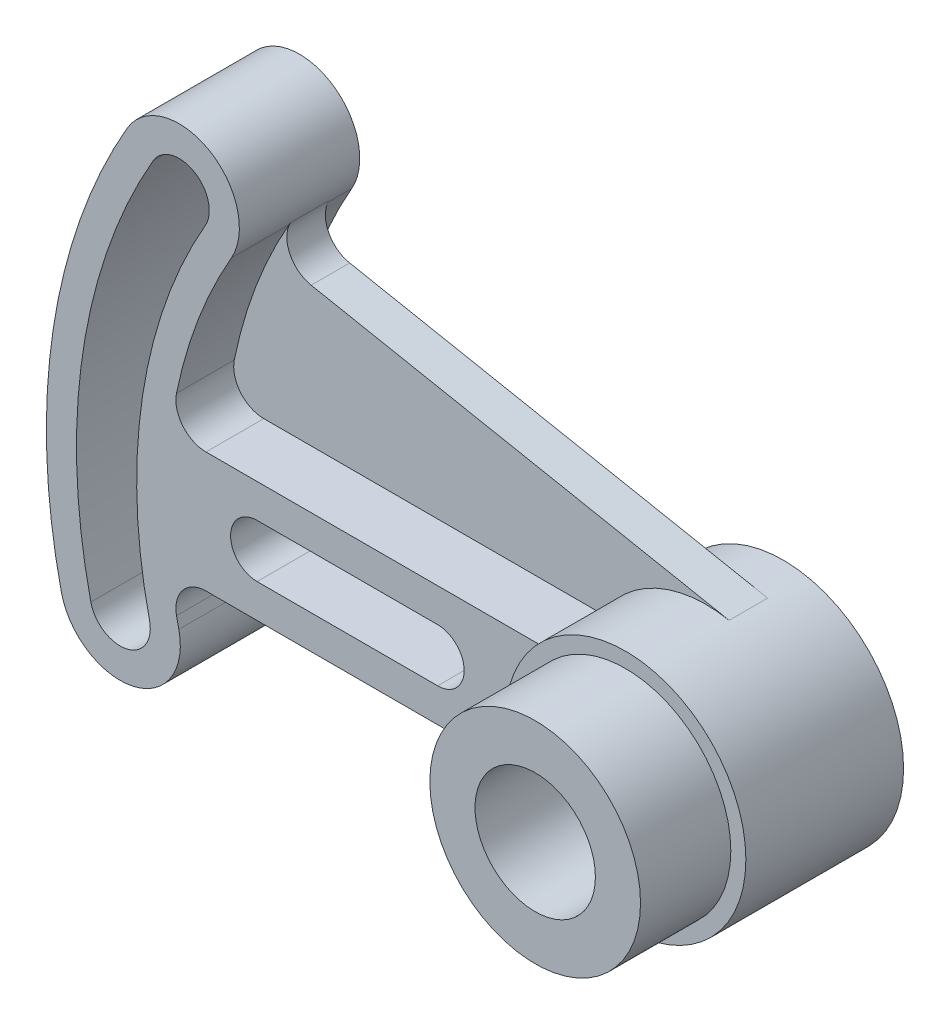
from build123d import *

# Parameters (mm, degrees)
SKETCH1_R           = 25.4
BOSS_EXTRUDE1_DEPTH = 33.274
SKETCH2_R           = 22.225
BOSS_EXTRUDE2_DEPTH = 19.05
SKETCH3_R           = 12.7
CUT_EXTRUDE2_DEPTH  = 64.467479673
BOSS_EXTRUDE3_DEPTH = 25.4
FILLET1_R           = 6.35
FILLET2_R           = 6.35
CUT_EXTRUDE3_DEPTH  = 154.088688922
BOSS_EXTRUDE4_DEPTH = 8.128
FILLET3_R           = 6.35


with BuildPart() as part:
    # Sketch1 → Boss-Extrude1 (new body)
    with BuildSketch(Plane.XY):
        Circle(SKETCH1_R)
    extrude(amount=BOSS_EXTRUDE1_DEPTH)

    # Sketch2 → Boss-Extrude2 (add)
    with BuildSketch(Plane.XY.offset(33.274)):
        with Locations(Location((0, 0, 0), (0, 0, 180))):
            Circle(SKETCH2_R)
    extrude(amount=BOSS_EXTRUDE2_DEPTH)

    # Sketch3 → Cut-Extrude2 (cut, through all)
    with BuildSketch(Plane.XY):
        Circle(SKETCH3_R)
    extrude(amount=CUT_EXTRUDE2_DEPTH, mode=Mode.SUBTRACT)

    # Sketch5 → Boss-Extrude3 (add)
    with BuildSketch(Plane(origin=(0, 0, 3.048), x_dir=(-1, 0, 0), z_dir=(0, 0, -1))):
        with BuildLine():
            Line((100.803124952, 12.7), (21.997045256, 12.7))
            ThreePointArc((21.997045256, 12.7), (24.534515988, 6.574003746), (25.4, 0))
            ThreePointArc((25.4, 0), (24.534515988, -6.574003746), (21.997045256, -12.7))
            Line((21.997045256, -12.7), (100.803124952, -12.7))
            ThreePointArc((100.803124952, -12.7), (100.053333913, -17.660418251), (99.059597973, -22.577777778))
            ThreePointArc((99.059597973, -22.577777778), (108.619825498, -37.782449747), (123.824497467, -28.222222222))
            ThreePointArc((123.824497467, -28.222222222), (125.578613792, 18.9476056), (109.985226281, 63.5))
            ThreePointArc((109.985226281, 63.5), (92.636703653, 68.148522628), (87.988181024, 50.8))
            ThreePointArc((87.988181024, 50.8), (96.298711326, 32.390094118), (100.803124952, 12.7))
        make_face()
    extrude(amount=-BOSS_EXTRUDE3_DEPTH)

    # Fillet1
    fillet1_edges = [part.edges().sort_by_distance(p)[0] for p in [
        (-100.803124952, 12.7, 15.748),
    ]]
    fillet(fillet1_edges, radius=FILLET1_R)

    # Fillet2
    fillet2_edges = [part.edges().sort_by_distance(p)[0] for p in [
        (-100.803124952, -12.7, 15.748),
    ]]
    fillet(fillet2_edges, radius=FILLET2_R)

    # Sketch6 → Cut-Extrude3 (cut, through all)
    with BuildSketch(Plane(origin=(0, 0, 3.048), x_dir=(-1, 0, 0), z_dir=(0, 0, -1))):
        with BuildLine():
            Line((44.45, -5.588), (82.55, -5.588))
            ThreePointArc((82.55, -5.588), (88.138, 0), (82.55, 5.588))
            Line((82.55, 5.588), (44.45, 5.588))
            ThreePointArc((44.45, 5.588), (38.862, 0), (44.45, -5.588))
        make_face()
        with BuildLine():
            ThreePointArc((117.620316517, -26.867892407), (119.3040242, 17.971430377), (104.485964967, 60.325))
            ThreePointArc((104.485964967, 60.325), (95.811703653, 62.649261314), (93.487442339, 53.975))
            ThreePointArc((93.487442339, 53.975), (106.745705863, 16.079700863), (105.239230568, -24.039693207))
            ThreePointArc((105.239230568, -24.039693207), (110.015673942, -31.644335781), (117.620316517, -26.867892407))
        make_face()
    extrude(amount=-CUT_EXTRUDE3_DEPTH, mode=Mode.SUBTRACT)

    # Sketch7 → Boss-Extrude4 (add)
    with BuildSketch(Plane.XY.offset(8.128)):
        with BuildLine():
            Line((-93.3255592, 12.7), (-21.997045256, 12.7))
            ThreePointArc((-21.997045256, 12.7), (-10.533208363, 23.11301628), (4.846548483, 24.93333046))
            Line((4.846548483, 24.93333046), (-91.719825153, 43.703932019))
            ThreePointArc((-91.719825153, 43.703932019), (-96.345611399, 32.250320373), (-99.547263147, 20.32))
            ThreePointArc((-99.547263147, 20.32), (-98.24424805, 15.033907372), (-93.3255592, 12.7))
        make_face()
    extrude(amount=BOSS_EXTRUDE4_DEPTH)

    # Fillet3
    # the kernel refuses this fillet: 6.35 mm, written as the material it adds along each edge
    with BuildSketch(Plane(origin=(-91.719825153, 43.703932019, 8.128), x_dir=(0.4664648604868203, 0.8845397299901295, 0), z_dir=(0, 0, 1))) as fillet3_piece_1:
        with BuildLine():
            CenterArc((8.551066202, -6.349980485), FILLET3_R, 90.142046539, 106.663020028)
            Line((2.472249714, -8.185869942), (1.864368065, -8.369458888))
            Line((1.864368065, -8.369458888), (-0.607881649, -0.183588946))
            Line((-0.607881649, -0.183588946), (-0.02578882, 0.634476112))
            ThreePointArc((-0.02578882, 0.634476112), (8.041755062, 0.643812976), (8.533749149, 0.634998049))
            Line((8.533749149, 0.634998049), (8.535323427, 0))
        make_face()
    extrude(amount=8.128)


solid = part.part
